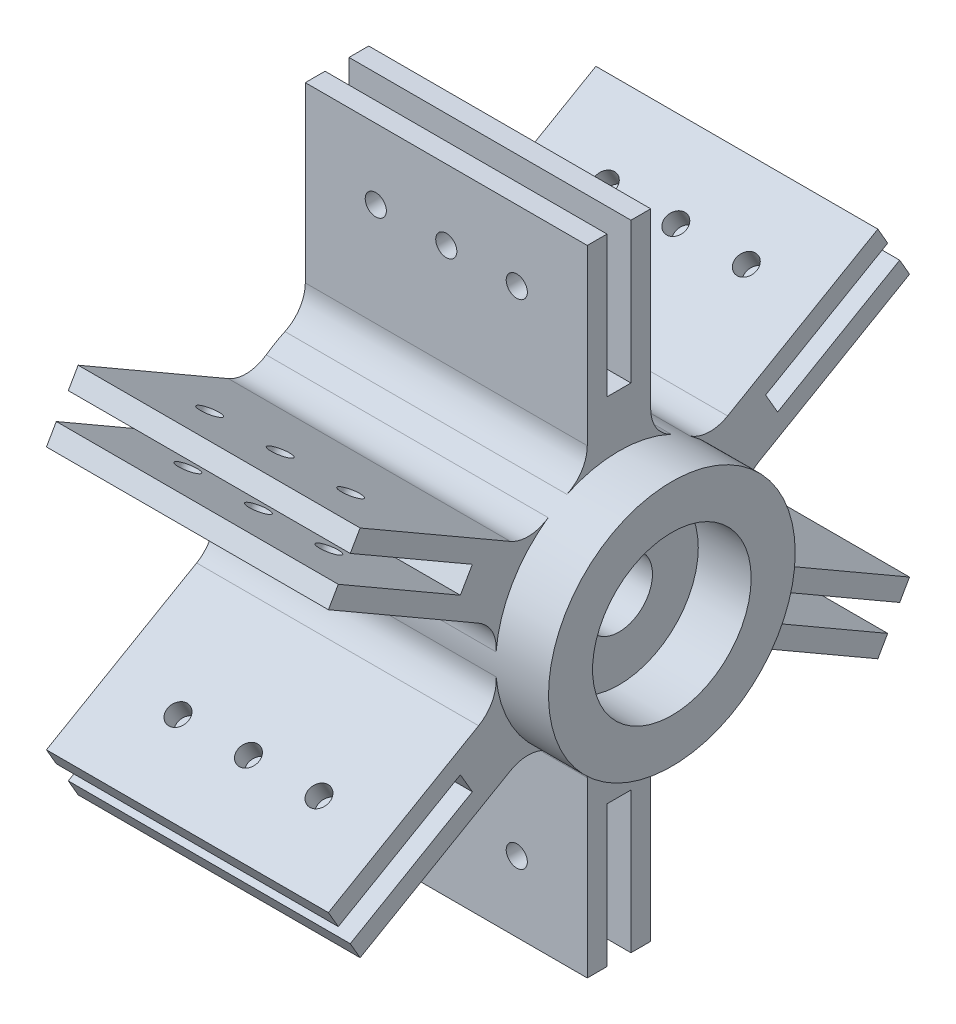
from build123d import *

# Parameters (mm, degrees)
SKETCH1_R                = 17.5
SKETCH1_R_2              = 4.75
MAINBODY_DEPTH           = 40
SKETCH2_R                = 17.5
SKETCH2_R_2              = 11.25
BEARINGHOUSING_DEPTH     = 7.5
SKETCH3_R                = 1.5
MOUNTINGHOLES_DEPTH      = 20
BOSS_EXTRUDE3_DEPTH      = 40
SKETCH6_R                = 1.5
CUT_EXTRUDE2_DEPTH       = 10
FILLET1_R                = 5
CIRPATTERN1_COUNT        = 6
FILLET1_OF_CIRPATTERN1_R = 5


with BuildPart() as part:
    # Sketch1 → MainBody (new body)
    with BuildSketch(Plane(origin=(0, 0, 0), x_dir=(0, 0, -1), z_dir=(1, 0, 0))):
        Circle(SKETCH1_R)
        Circle(SKETCH1_R_2, mode=Mode.SUBTRACT)
    extrude(amount=MAINBODY_DEPTH)

    # Sketch2 → BearingHousing (add)
    with BuildSketch(Plane(origin=(40, 0, 0), x_dir=(0, 0, -1), z_dir=(1, 0, 0))):
        Circle(SKETCH2_R)
        Circle(SKETCH2_R_2, mode=Mode.SUBTRACT)
    extrude(amount=BEARINGHOUSING_DEPTH)

    # Sketch3 → MountingHoles (cut)
    with BuildSketch(Plane.ZY):
        with Locations((0, 13)):
            Circle(SKETCH3_R)
        with Locations((11.258330249, 6.5)):
            Circle(SKETCH3_R)
        with Locations((11.258330249, -6.5)):
            Circle(SKETCH3_R)
        with Locations((0, -13)):
            Circle(SKETCH3_R)
        with Locations((-11.258330249, -6.5)):
            Circle(SKETCH3_R)
        with Locations((-11.258330249, 6.5)):
            Circle(SKETCH3_R)
    extrude(amount=-MOUNTINGHOLES_DEPTH, mode=Mode.SUBTRACT)

    # Sketch4 → Boss-Extrude3 (add)
    with BuildSketch(Plane.ZY):
        with BuildLine():
            Line((-4.5, 16.911534525), (-4.5, 45))
            Line((-4.5, 45), (-1.7, 45))
            Line((-1.7, 45), (-1.7, 25))
            Line((-1.7, 25), (1.7, 25))
            Line((1.7, 25), (1.7, 45))
            Line((1.7, 45), (4.5, 45))
            Line((4.5, 45), (4.5, 16.911534525))
            ThreePointArc((4.5, 16.911534525), (0, 17.5), (-4.5, 16.911534525))
        make_face()
    boss_extrude3 = extrude(amount=-BOSS_EXTRUDE3_DEPTH)

    # Sketch6 → Cut-Extrude2 (cut)
    with BuildSketch(Plane(origin=(0, 0, -4.5), x_dir=(-1, 0, 0), z_dir=(0, 0, -1))):
        with Locations((-30, 35)):
            Circle(SKETCH6_R)
        with Locations((-20, 35)):
            Circle(SKETCH6_R)
        with Locations((-10, 35)):
            Circle(SKETCH6_R)
    cut_extrude2 = extrude(amount=-CUT_EXTRUDE2_DEPTH, mode=Mode.SUBTRACT)

    # Fillet1
    fillet1_edges = [part.edges().sort_by_distance(p)[0] for p in [
        (20, 16.911534525, -4.5),
        (20, 16.911534525, 4.5),
    ]]
    fillet(fillet1_edges, radius=FILLET1_R)

    # CirPattern1: Boss-Extrude3, Cut-Extrude2 ×6 about axis
    cirpattern1_axis = Axis((40, 0, 0), (-1, 0, 0))
    add([boss_extrude3.rotate(cirpattern1_axis, i * 360 / CIRPATTERN1_COUNT) for i in range(1, CIRPATTERN1_COUNT)])
    add([cut_extrude2.rotate(cirpattern1_axis, i * 360 / CIRPATTERN1_COUNT) for i in range(1, CIRPATTERN1_COUNT)], mode=Mode.SUBTRACT)

    # Fillet1 of CirPattern1
    fillet1_of_cirpattern1_edges = [part.edges().sort_by_distance(p)[0] for p in [
        (20, 4.558652946, -16.895818516),
        (20, 12.35288158, -12.395818516),
        (20, -12.35288158, -12.395818516),
        (20, -4.558652946, -16.895818516),
        (20, -16.911534525, 4.5),
        (20, -16.911534525, -4.5),
        (20, -4.558652946, 16.895818516),
        (20, -12.35288158, 12.395818516),
        (20, 12.35288158, 12.395818516),
        (20, 4.558652946, 16.895818516),
    ]]
    fillet(fillet1_of_cirpattern1_edges, radius=FILLET1_OF_CIRPATTERN1_R)


solid = part.part
